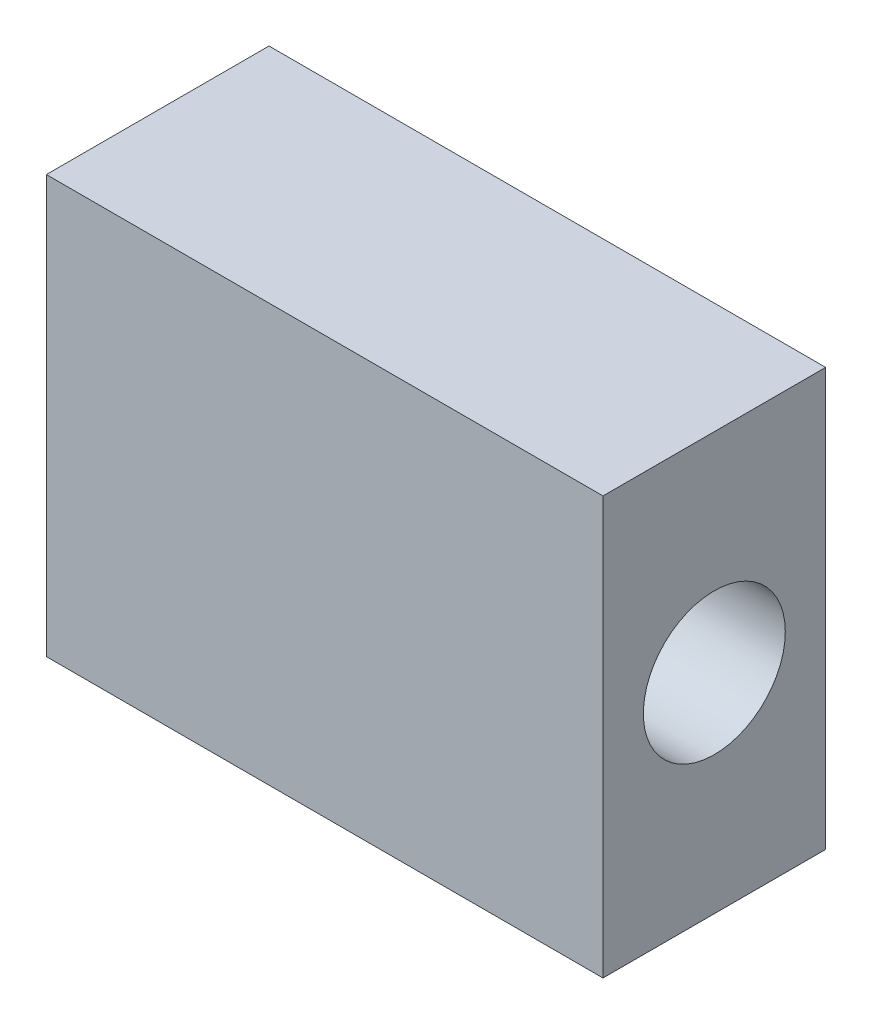
from build123d import *

# Parameters (mm, degrees)
CROQUIS1_W              = 40
CROQUIS1_H              = 30
SALIENTE_EXTRUIR1_DEPTH = 16
CROQUIS2_R              = 5.1
CORTAR_EXTRUIR1_DEPTH   = 53.497618994


with BuildPart() as part:
    # Croquis1 → Saliente-Extruir1 (new body)
    with BuildSketch(Plane.XY):
        with Locations((20, 15)):
            Rectangle(CROQUIS1_W, CROQUIS1_H)
    extrude(amount=SALIENTE_EXTRUIR1_DEPTH)

    # Croquis2 → Cortar-Extruir1 (cut, through all)
    with BuildSketch(Plane(origin=(40, 0, 0), x_dir=(0, 0, -1), z_dir=(1, 0, 0))):
        with Locations((-8, 15)):
            Circle(CROQUIS2_R)
    extrude(amount=-CORTAR_EXTRUIR1_DEPTH, mode=Mode.SUBTRACT)


solid = part.part
